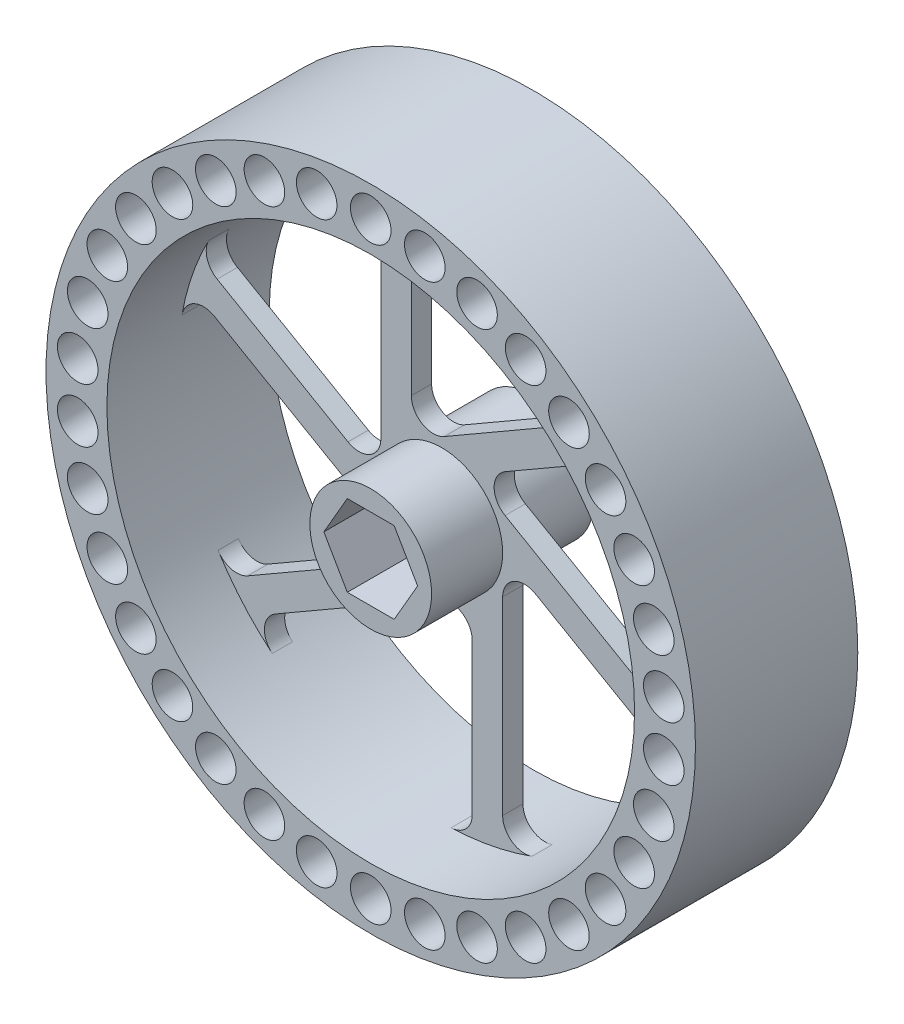
from build123d import *

# Parameters (mm, degrees)
SKETCH1_R           = 50.8
BOSS_EXTRUDE1_DEPTH = 12.7
SKETCH2_R           = 3.1749999999999976
CUT_EXTRUDE1_DEPTH  = 77.2
CIRPATTERN1_COUNT   = 34
SKETCH4_R           = 41.275
SKETCH4_R_2         = 9.525
CUT_EXTRUDE3_DEPTH  = 77.2
BOSS_EXTRUDE2_DEPTH = 1.5875
CIRPATTERN3_COUNT   = 6
FILLET1_R           = 3.429


with BuildPart() as part:
    # Sketch1 → Boss-Extrude1 (new, symmetric)
    with BuildSketch(Plane.XY):
        Circle(SKETCH1_R)
        Polygon((-3.6661742093541254, 6.350000000000001), (-7.3323484187082455, 2.8e-16), (-3.666174209354112, -6.350000000000009), (3.666174209354129, -6.350000000000007), (7.332348418708255, -6.1e-16), (3.666174209354128, 6.350000000000001), align=None, mode=Mode.SUBTRACT)
    extrude(amount=BOSS_EXTRUDE1_DEPTH, both=True)

    # Sketch2 → Cut-Extrude1 (cut, through all)
    with BuildSketch(Plane.XY.offset(12.7)):
        with Locations((0, 46.0375)):
            Circle(SKETCH2_R)
    cut_extrude1 = extrude(amount=-CUT_EXTRUDE1_DEPTH, mode=Mode.SUBTRACT)

    # CirPattern1: Cut-Extrude1 ×34 about axis
    cirpattern1_axis = Axis((9.82e-15, -1.35e-15, 0), (0, 0, 1))
    for i in range(1, CIRPATTERN1_COUNT):
        add(cut_extrude1.rotate(cirpattern1_axis, i * 360 / CIRPATTERN1_COUNT), mode=Mode.SUBTRACT)

    # Sketch4 → Cut-Extrude3 (cut, through all)
    with BuildSketch(Plane.XY.offset(12.7)):
        Circle(SKETCH4_R)
        Circle(SKETCH4_R_2, mode=Mode.SUBTRACT)
    extrude(amount=-CUT_EXTRUDE3_DEPTH, mode=Mode.SUBTRACT)


with BuildPart() as cut_extrude3_piece_1:
    # of the separate pieces the step leaves, piece 1, a body of its own (cut_extrude3_pieces)
    add(part.part.solids().sort_by_distance((50.8, 0, -12.7))[0])



with BuildPart() as cut_extrude3_piece_2:
    # of the separate pieces the step leaves, piece 2, a body of its own (cut_extrude3_pieces)
    add(part.part.solids().sort_by_distance((9.525, 0, -12.7))[0])


with BuildPart() as cut_extrude3_piece_1_1:
    add(cut_extrude3_piece_1.part)

    add(cut_extrude3_piece_2.part)  # Boss-Extrude2 merges Cut-Extrude3 piece 2
    # Sketch5 → Boss-Extrude2 (add, symmetric)
    with BuildSketch(Plane.XY):
        with BuildLine():
            Line((-9.525000000000002, -5.3e-16), (-9.525000000000002, 40.16092628413842))
            ThreePointArc((-9.525000000000002, 40.16092628413842), (-7.156038705680682, 40.64992909025549), (-4.762500000000001, 40.99931973521024))
            Line((-4.762500000000001, 40.99931973521024), (-4.762500000000002, 8.248891971046778))
            ThreePointArc((-4.762500000000002, 8.248891971046778), (-8.24889197104678, 4.762499999999999), (-9.525000000000002, -5.3e-16))
        make_face()
    boss_extrude2 = extrude(amount=BOSS_EXTRUDE2_DEPTH, both=True)

    # CirPattern3: Boss-Extrude2 ×6 about axis
    cirpattern3_axis = Axis((1.9e-16, 5e-16, 0), (0, 0, 1))
    for i in range(1, CIRPATTERN3_COUNT):
        add(boss_extrude2.rotate(cirpattern3_axis, i * 360 / CIRPATTERN3_COUNT))

    # Fillet1
    # the kernel refuses this fillet: 3.429 mm, written as the material it adds along each edge
    with BuildSketch(Plane(origin=(4.762500000000001, -8.248891971046781, 1.5875), x_dir=(-0.8660254037844388, -0.4999999999999998, 0), z_dir=(0, 0, -1))) as fillet1_piece_1:
        with BuildLine():
            CenterArc((FILLET1_R * 1.73205080757, -FILLET1_R), FILLET1_R, 90.00000000000001, 119.99999999999994)
            Line((FILLET1_R * 0.866025403784, -FILLET1_R * 1.5), (0, 0))
            Line((0, 0), (FILLET1_R * 1.73205080757, -3.1e-16))
        make_face()
    extrude(amount=3.175)
    with BuildSketch(Plane(origin=(4.762499999999996, -40.99931973521025, -1.5875), x_dir=(-0.997155587206214, -0.07537065014599859, 0), z_dir=(0, 0, 1))) as fillet1_piece_2:
        with BuildLine():
            CenterArc((3.179807527236001, -3.4262296726380295), FILLET1_R, 87.69670970842637, 87.9807710183247)
            Line((-0.2394389812941072, -3.1677837132874003), (0, 0))
            ThreePointArc((0, 0), (1.658808100082997, 0.0333465330607883), (3.3176162001659595, 0))
        make_face()
    extrude(amount=3.175)
    with BuildSketch(Plane(origin=(9.524999999999997, -40.16092628413843, -1.5875), x_dir=(0.9579269436382062, 0.28701214373605355, 0), z_dir=(0, 0, 1))) as fillet1_piece_3:
        with BuildLine():
            CenterArc((4.60525320571754, 3.4231866123984873), FILLET1_R, 163.32083830001451, 110.01595960288256)
            Line((1.3205217159821292, 4.407351253269408), (0, 0))
            ThreePointArc((0, 0), (2.4024194090821527, -0.06997596187006355), (4.804838818164359, 1e-17))
        make_face()
    extrude(amount=3.175)
    with BuildSketch(Plane(origin=(-4.7625, -8.24889197104678, 1.5875), x_dir=(-0.8660254037844387, 0.5000000000000001, 0), z_dir=(0, 0, -1))) as fillet1_piece_4:
        with BuildLine():
            CenterArc((FILLET1_R * 1.73205080757, -FILLET1_R), FILLET1_R, 90.00000000000001, 119.99999999999989)
            Line((FILLET1_R * 0.866025403784, -FILLET1_R * 1.5), (0, 0))
            Line((0, 0), (FILLET1_R * 1.73205080757, 6e-17))
        make_face()
    extrude(amount=3.175)
    with BuildSketch(Plane(origin=(-33.12520242857276, -24.624105853128505, -1.5875), x_dir=(-0.5638506913292745, 0.8258767449731825, 0), z_dir=(0, 0, 1))) as fillet1_piece_5:
        with BuildLine():
            CenterArc((3.1798075272377853, -3.4262296726380246), FILLET1_R, 87.69670970842493, 87.98077101816266)
            Line((-0.23943898129158525, -3.1677837132776396), (0, 0))
            ThreePointArc((0, 0), (1.6588081000839316, 0.03334653306082312), (3.31761620016783, 7e-17))
        make_face()
    extrude(amount=3.175)
    with BuildSketch(Plane(origin=(-30.01788240157806, -28.329355113115984, -1.5875), x_dir=(0.7275232794891553, -0.6860829962922449, 0), z_dir=(0, 0, 1))) as fillet1_piece_6:
        with BuildLine():
            CenterArc((4.605253205717517, 3.423186612398488), FILLET1_R, 163.3208383000144, 110.01595960288273)
            Line((1.320521715982109, 4.407351253269417), (0, 0))
            ThreePointArc((0, 0), (2.4024194090821513, -0.06997596187006543), (4.80483881816434, 2.2e-16))
        make_face()
    extrude(amount=3.175)
    with BuildSketch(Plane(origin=(-37.88770242857276, 16.375213882081738, -1.5875), x_dir=(0.43330489587692217, 0.9012473951191702, 0), z_dir=(0, 0, 1))) as fillet1_piece_7:
        with BuildLine():
            CenterArc((3.1798075272360076, -3.426229672638027), FILLET1_R, 87.69670970842628, 87.9807710183247)
            Line((-0.23943898129410104, -3.167783713287394), (0, 0))
            ThreePointArc((0, 0), (1.658808100082987, 0.03334653306078433), (3.3176162001659715, 3e-17))
        make_face()
    extrude(amount=3.175)
    with BuildSketch(Plane(origin=(-39.542882401578055, 11.831571171022437, -1.5875), x_dir=(-0.2304036641490512, -0.9730951400282972, 0), z_dir=(0, 0, 1))) as fillet1_piece_8:
        with BuildLine():
            CenterArc((4.605253205717527, 3.4231866123984873), FILLET1_R, 163.32083830001446, 110.01595960288267)
            Line((1.3205217159821168, 4.407351253269412), (0, 0))
            ThreePointArc((0, 0), (2.402419409082178, -0.06997596187006307), (4.80483881816435, -1.2e-16))
        make_face()
    extrude(amount=3.175)
    with BuildSketch(Plane(origin=(-9.525000000000002, -7.1e-16, 1.5875), x_dir=(0, 1, 0), z_dir=(0, 0, -1))) as fillet1_piece_9:
        with BuildLine():
            CenterArc((FILLET1_R * 1.73205080757, -FILLET1_R), FILLET1_R, 90, 119.99999999999991)
            Line((FILLET1_R * 0.866025403784, -FILLET1_R * 1.5), (0, 0))
            Line((0, 0), (FILLET1_R * 1.73205080757, 0))
        make_face()
    extrude(amount=3.175)
    with BuildSketch(Plane(origin=(-4.762500000000003, 8.248891971046778, 1.5875), x_dir=(0.8660254037844384, 0.5000000000000002, 0), z_dir=(0, 0, -1))) as fillet1_piece_10:
        with BuildLine():
            CenterArc((FILLET1_R * 1.73205080757, -FILLET1_R), FILLET1_R, 89.99999999999999, 120.00000000000006)
            Line((FILLET1_R * 0.866025403784, -FILLET1_R * 1.5), (0, 0))
            Line((0, 0), (FILLET1_R * 1.73205080757, 1.6e-16))
        make_face()
    extrude(amount=3.175)
    with BuildSketch(Plane(origin=(-4.762500000000001, 40.99931973521025, -1.5875), x_dir=(0.997155587206214, 0.07537065014599839, 0), z_dir=(0, 0, 1))) as fillet1_piece_11:
        with BuildLine():
            CenterArc((3.1798075272360102, -3.4262296726380295), FILLET1_R, 87.69670970842638, 87.98077101832455)
            Line((-0.2394389812940972, -3.167783713287394), (0, 0))
            ThreePointArc((0, 0), (1.6588081000829877, 0.03334653306078932), (3.3176162001659684, -2e-17))
        make_face()
    extrude(amount=3.175)
    with BuildSketch(Plane(origin=(-9.525000000000002, 40.16092628413843, -1.5875), x_dir=(-0.9579269436382061, -0.287012143736054, 0), z_dir=(0, 0, 1))) as fillet1_piece_12:
        with BuildLine():
            CenterArc((4.605253205717536, 3.4231866123984873), FILLET1_R, 163.3208383000144, 110.01595960288265)
            Line((1.3205217159821265, 4.407351253269416), (0, 0))
            ThreePointArc((0, 0), (2.4024194090821784, -0.06997596187006504), (4.804838818164352, -1.4e-16))
        make_face()
    extrude(amount=3.175)
    with BuildSketch(Plane(origin=(4.762500000000005, 8.24889197104678, 1.5875), x_dir=(0.8660254037844382, 0.5000000000000008, 0), z_dir=(0, 0, -1))) as fillet1_piece_13:
        with BuildLine():
            CenterArc((FILLET1_R * 1.73205080757, FILLET1_R), FILLET1_R, 150, 120.00000000000006)
            Line((FILLET1_R * 0.866025403784, FILLET1_R * 1.5), (0, 0))
            Line((0, 0), (FILLET1_R * 1.73205080757, 1.3e-16))
        make_face()
    extrude(amount=3.175)
    with BuildSketch(Plane(origin=(33.125202428572756, 24.62410585312852, -1.5875), x_dir=(-0.8660254037844386, -0.5000000000000002, 0), z_dir=(0, 0, 1))) as fillet1_piece_14:
        with BuildLine():
            CenterArc((3.1768199004459188, 3.429), FILLET1_R, 182.01922898164983, 87.9807710183502)
            ThreePointArc((-0.2500508899513492, 3.308179530202866), (-0.15827712672630737, 1.6515764152248933), (0, 0))
            Line((0, 0), (3.1768199004459197, -4e-17))
        make_face()
    extrude(amount=3.175)
    with BuildSketch(Plane(origin=(30.01788240157805, 28.329355113115994, -1.5875), x_dir=(-0.8660254037844389, -0.4999999999999996, 0), z_dir=(0, 0, 1))) as fillet1_piece_15:
        with BuildLine():
            CenterArc((4.600926284138431, -3.429), FILLET1_R, 90.00000000000006, 110.01595960288267)
            ThreePointArc((1.3790470895075613, -4.602684563758393), (0.6224916854714433, -2.321426232705517), (0, 0))
            Line((0, 0), (4.600926284138428, 2e-17))
        make_face()
    extrude(amount=3.175)
    with BuildSketch(Plane(origin=(9.525000000000002, 5.4e-16, 1.5875), x_dir=(0, -1, 0), z_dir=(0, 0, -1))) as fillet1_piece_16:
        with BuildLine():
            CenterArc((FILLET1_R * 1.73205080757, -FILLET1_R), FILLET1_R, 90, 119.99999999999997)
            Line((FILLET1_R * 0.866025403784, -FILLET1_R * 1.5), (0, 0))
            Line((0, 0), (FILLET1_R * 1.73205080757, 0))
        make_face()
    extrude(amount=3.175)
    with BuildSketch(Plane(origin=(37.88770242857275, -16.375213882081752, -1.5875), x_dir=(-0.43330489587692167, -0.9012473951191704, 0), z_dir=(0, 0, 1))) as fillet1_piece_17:
        with BuildLine():
            CenterArc((3.179807527235993, -3.426229672638027), FILLET1_R, 87.69670970842625, 87.9807710183247)
            Line((-0.23943898129411542, -3.167783713287392), (0, 0))
            ThreePointArc((0, 0), (1.6588081000829966, 0.0333465330607801), (3.3176162001659586, -8e-17))
        make_face()
    extrude(amount=3.175)
    with BuildSketch(Plane(origin=(39.54288240157805, -11.831571171022452, -1.5875), x_dir=(0.2304036641490521, 0.9730951400282969, 0), z_dir=(0, 0, 1))) as fillet1_piece_18:
        with BuildLine():
            CenterArc((4.605253205717535, 3.4231866123984864), FILLET1_R, 163.32083830001451, 110.01595960288267)
            Line((1.3205217159821225, 4.4073512532694075), (0, 0))
            ThreePointArc((0, 0), (2.402419409082188, -0.06997596187006555), (4.80483881816436, -2e-17))
        make_face()
    extrude(amount=3.175)


solid = cut_extrude3_piece_1_1.part
